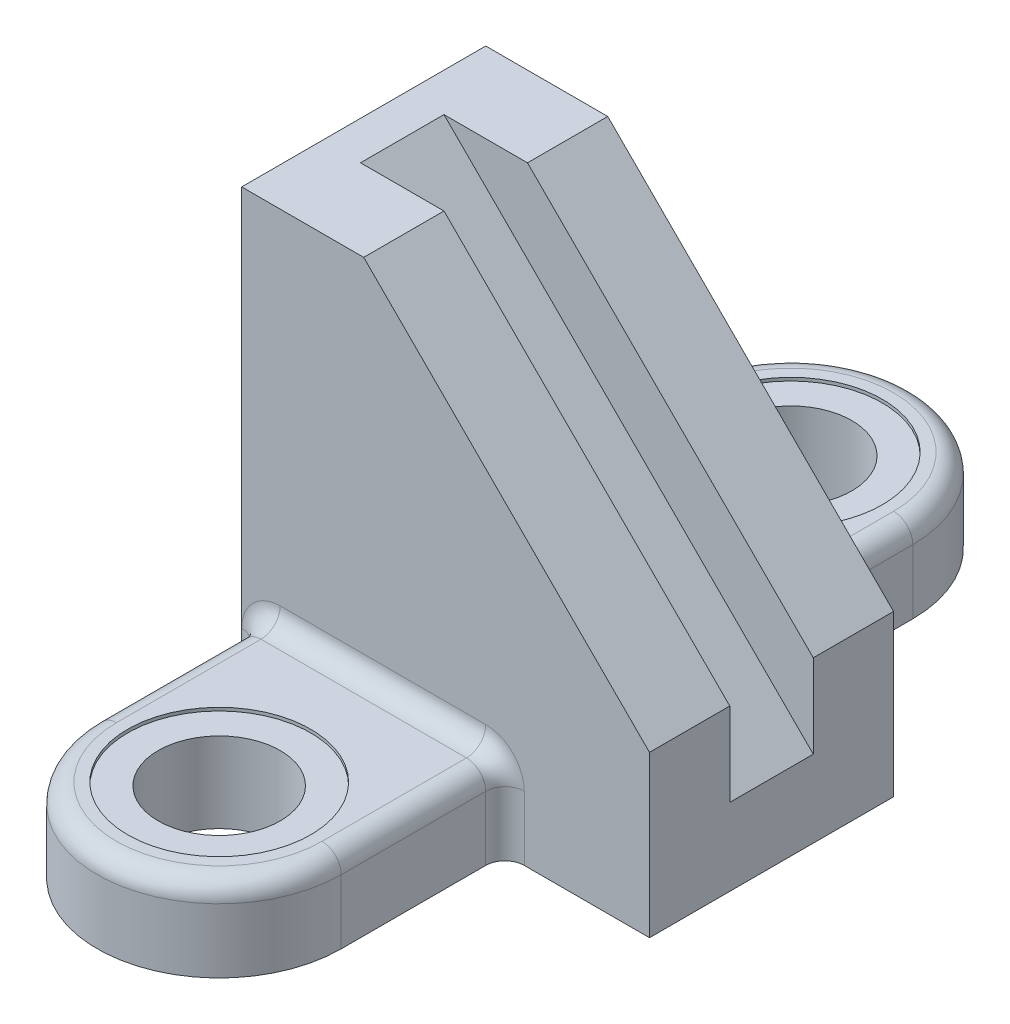
from build123d import *

# Parameters (mm, degrees)
EXTRUDE_1_DEPTH               = 38
SKETCH_2_W                    = 52
SKETCH_2_H                    = 26
CUT_EXTRUDE_1_DEPTH           = 273.053680503
EXTRUDE_2_DEPTH               = 26
HOLE_WIZARD_M36_1_D           = 38
HOLE_WIZARD_M36_1_CBORE_D     = 57
HOLE_WIZARD_M36_1_CBORE_DEPTH = 1
FILLET_2_R                    = 6


with BuildPart() as part:
    # 스케치1 → 보스-돌출1 (new, symmetric)
    with BuildSketch(Plane.XY):
        Polygon((0, 0), (127, 0), (127, 50), (38, 139), (0, 139), align=None)
    extrude(amount=EXTRUDE_1_DEPTH, both=True)

    # 스케치2 → 컷-돌출1 (cut, through all, along a direction that is not the sketch's normal)
    with BuildSketch(Plane(origin=(0, 139, 0), x_dir=(1, 0, 0), z_dir=(0, 1, 0))):
        with Locations((38, 0)):
            Rectangle(SKETCH_2_W, SKETCH_2_H)
    extrude(amount=-CUT_EXTRUDE_1_DEPTH, dir=(-0.7071067811865512, 0.7071067811865438, 0), mode=Mode.SUBTRACT)

    # 스케치3 → 보스-돌출2 (add)
    with BuildSketch(Plane.XZ):
        with BuildLine():
            Line((6, 38), (82, 38))
            Line((82, 38), (82, 89))
            ThreePointArc((82, 89), (44, 127), (6, 89))
            Line((6, 89), (6, 38))
        make_face()
    extrude_2 = extrude(amount=-EXTRUDE_2_DEPTH)

    # M36 소켓 머리 캡 나사용 카운터보어1 (through all)
    with Locations(Plane(origin=(0, 26, 0), x_dir=(1, 0, 0), z_dir=(0, 1, 0))):
        with Locations((44, -89)):
            hole_wizard_m36_1 = CounterBoreHole(HOLE_WIZARD_M36_1_D / 2, HOLE_WIZARD_M36_1_CBORE_D / 2, HOLE_WIZARD_M36_1_CBORE_DEPTH)

    # 대칭 복사1: 보스-돌출2, M36 소켓 머리 캡 나사용 카운터보어1 across plane
    add(extrude_2.mirror(Plane.XY))
    add(hole_wizard_m36_1.mirror(Plane.XY), mode=Mode.SUBTRACT)

    # 필렛2
    fillet_2_edges = [part.edges().sort_by_distance(p)[0] for p in [
        (6, 26, 63.5),
        (6, 13, 38),
        (44, 26, 127),
        (82, 26, 63.5),
        (44, 26, 38),
        (82, 13, 38),
        (6, 13, -38),
        (82, 13, -38),
        (6, 26, -63.5),
        (44, 26, -38),
        (82, 26, -63.5),
        (44, 26, -127),
    ]]
    fillet(fillet_2_edges, radius=FILLET_2_R - 0.0001)  # a hair under: the kernel refuses the full size


solid = part.part
